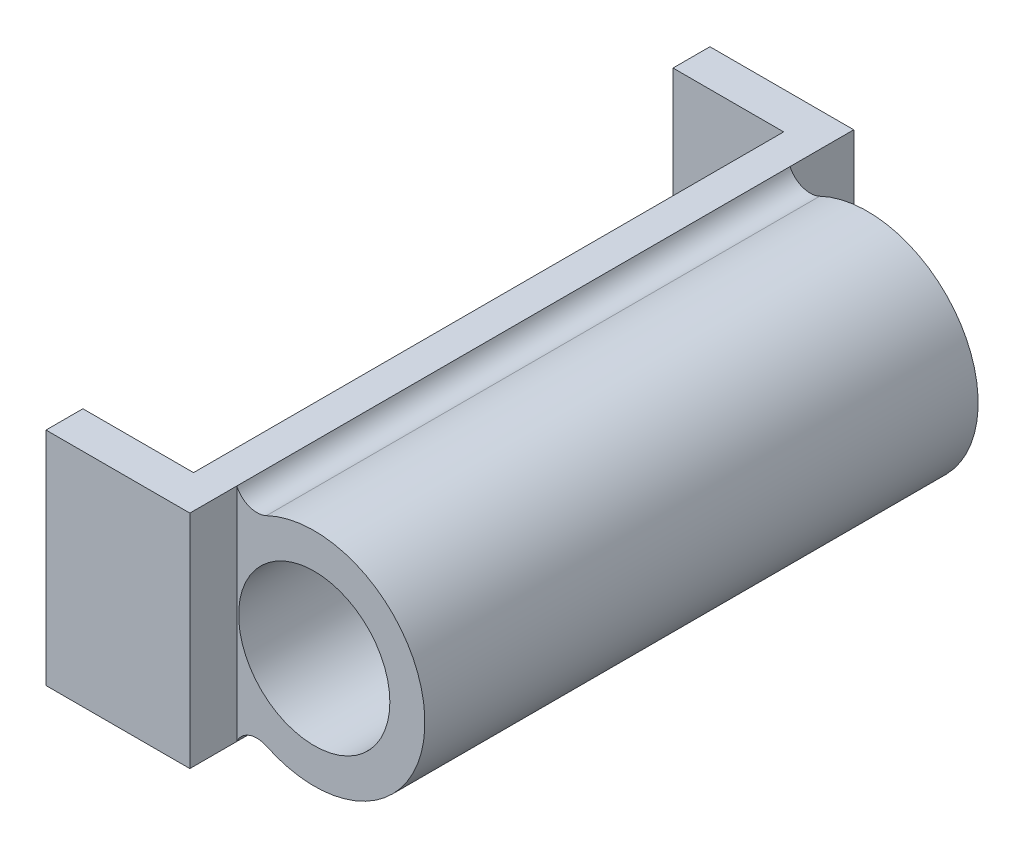
from build123d import *

# Parameters (mm, degrees)
SKETCH_1_W            = 30
SKETCH_1_H            = 30
SKETCH_1_R            = 9.807439468
EXTRUDE_1_DEPTH       = 60
SKETCH_2_W            = 30
SKETCH_2_H            = 30
SKETCH_2_R            = 10.25
EXTRUDE_2_DEPTH       = 50
SKETCH_6_R            = 10.25
CUT_EXTRUDE_1_DEPTH   = 60
SKETCH_7_W            = 30
SKETCH_7_H            = 30
SKETCH_7_R            = 10.25
REVOLVE_1_ANGLE       = 90
FILLET_2_R            = 15
SKETCH_9_W            = 65.452723958
SKETCH_9_H            = 141.93468868
CUT_EXTRUDE_3_DEPTH   = 30
SKETCH_19_W           = 90
SKETCH_19_H           = 60
EXTRUDE_9_DEPTH       = 4.5
SKETCH_20_W           = 5
SKETCH_20_H           = 60
EXTRUDE_10_DEPTH      = 15
EXTRUDE_11_DEPTH      = 25
EXTRUDE_11_DEPTH_BACK = 50
SKETCH_22_R           = 15
SKETCH_22_R_2         = 10.25
SKETCH_26_W           = 90
SKETCH_26_H           = 15
CUT_EXTRUDE_4_DEPTH   = 20
FILLET_4_R            = 3


with BuildPart() as part:
    # 스케치1 → 보스-돌출1 (new body)
    with BuildSketch(Plane.XY):
        Rectangle(SKETCH_1_W, SKETCH_1_H)
        Circle(SKETCH_1_R, mode=Mode.SUBTRACT)
    extrude(amount=EXTRUDE_1_DEPTH)

    # 스케치6 → 컷-돌출1 (cut)
    with BuildSketch(Plane.XY.offset(60)):
        Circle(SKETCH_6_R)
    extrude(amount=-CUT_EXTRUDE_1_DEPTH, mode=Mode.SUBTRACT)



with BuildPart() as body_2:
    # 스케치2 → 보스-돌출2 (new body)
    with BuildSketch(Plane.XZ.offset(15)):
        with Locations((0, 75)):
            Rectangle(SKETCH_2_W, SKETCH_2_H)
        with Locations((0, 75)):
            Circle(SKETCH_2_R, mode=Mode.SUBTRACT)
    extrude(amount=EXTRUDE_2_DEPTH)


with BuildPart() as part_1:
    add(part.part)

    add(body_2.part)  # 회전1 merges body 2
    # 스케치7 → 회전1 (revolve)
    with BuildSketch(Plane(origin=(0, -15, 0), x_dir=(1, 0, 0), z_dir=(0, 1, 0))):
        with Locations((0, -75)):
            Rectangle(SKETCH_7_W, SKETCH_7_H)
        with Locations(Location((0, -75, 0), (0, 0, 270))):
            Circle(SKETCH_7_R, mode=Mode.SUBTRACT)
    revolve(axis=Axis((15, -15, 60), (-1, 0, 0)), revolution_arc=REVOLVE_1_ANGLE)

    # 필렛2
    # the kernel refuses this fillet: 15 mm, written as the material it adds along each edge
    with BuildSketch(Plane(origin=(15, -15, 60), x_dir=(0, 0, -1), z_dir=(-1, 0, 0))) as fillet_2_piece_1:
        with BuildLine():
            CenterArc((FILLET_2_R, FILLET_2_R), FILLET_2_R, 180, 90)
            Line((0, FILLET_2_R), (0, 0))
            Line((0, 0), (FILLET_2_R, 0))
        make_face()
    extrude(amount=30)
    # the kernel refuses this fillet: 15 mm, written as the material it takes off along each edge
    with BuildSketch(Plane(origin=(15, -15, 60), x_dir=(0, 0, 1), z_dir=(0, -1, 0))) as fillet_2_2_piece_1:
        with BuildLine():
            CenterArc((30 - FILLET_2_R, FILLET_2_R), FILLET_2_R, 270, 90)
            Line((30, FILLET_2_R), (30, 0))
            Line((30, 0), (30 - FILLET_2_R, 0))
        make_face()
    revolve(axis=Axis((15, -15, 60), (-1, 0, 0)), revolution_arc=90, mode=Mode.SUBTRACT)
    with BuildSketch(Plane(origin=(-15, -15, 60), x_dir=(0, 0, 1), z_dir=(0, -1, 0))) as fillet_2_2_piece_2:
        with BuildLine():
            CenterArc((30 - FILLET_2_R, -FILLET_2_R), FILLET_2_R, 0, 90)
            Line((30, -FILLET_2_R), (30, 0))
            Line((30, 0), (30 - FILLET_2_R, 0))
        make_face()
    revolve(axis=Axis((-15, -15, 60), (-1, 0, 0)), revolution_arc=90, mode=Mode.SUBTRACT)
    with BuildSketch(Plane(origin=(-15, 15, -37.5), x_dir=(0, -1, 0), z_dir=(0, 0, 1))) as fillet_2_2_piece_3:
        with BuildLine():
            CenterArc((FILLET_2_R, FILLET_2_R), FILLET_2_R, 180, 90)
            Line((0, FILLET_2_R), (0, 0))
            Line((0, 0), (FILLET_2_R, 0))
        make_face()
    extrude(amount=97.5, mode=Mode.SUBTRACT)
    with BuildSketch(Plane(origin=(15, 15, -37.5), x_dir=(0, -1, 0), z_dir=(0, 0, 1))) as fillet_2_2_piece_4:
        with BuildLine():
            CenterArc((FILLET_2_R, -FILLET_2_R), FILLET_2_R, 90, 90)
            Line((0, -FILLET_2_R), (0, 0))
            Line((0, 0), (FILLET_2_R, 0))
        make_face()
    extrude(amount=97.5, mode=Mode.SUBTRACT)
    with BuildSketch(Plane(origin=(-15, -15, 90), x_dir=(0, 0, -1), z_dir=(0, -1, 0))) as fillet_2_2_piece_5:
        with BuildLine():
            CenterArc((FILLET_2_R, FILLET_2_R), FILLET_2_R, 180, 90)
            Line((0, FILLET_2_R), (0, 0))
            Line((0, 0), (FILLET_2_R, 0))
        make_face()
    extrude(amount=87.5, mode=Mode.SUBTRACT)
    with BuildSketch(Plane(origin=(15, -15, 90), x_dir=(0, 0, -1), z_dir=(0, -1, 0))) as fillet_2_2_piece_6:
        with BuildLine():
            CenterArc((FILLET_2_R, -FILLET_2_R), FILLET_2_R, 90, 90)
            Line((0, -FILLET_2_R), (0, 0))
            Line((0, 0), (FILLET_2_R, 0))
        make_face()
    extrude(amount=87.5, mode=Mode.SUBTRACT)
    # the kernel refuses this fillet: 15 mm, written as the material it takes off along each edge
    with BuildSketch(Plane(origin=(-15, -15, 45), x_dir=(1, 0, 0), z_dir=(0, 0, -1)), Plane(origin=(15, -15, -37.5), x_dir=(-1, 0, 0), z_dir=(0, 0, 1))) as fillet_2_3_piece_1:
        with BuildLine():
            CenterArc((FILLET_2_R, -FILLET_2_R), FILLET_2_R, 90, 90)
            Line((0, -FILLET_2_R), (0, 0))
            Line((0, 0), (FILLET_2_R, 0))
        make_face()
    extrude(amount=82.5, mode=Mode.SUBTRACT)
    with BuildSketch(Plane(origin=(15, -30, 60), x_dir=(0, 0, 1), z_dir=(0, -1, 0))) as fillet_2_3_piece_2:
        with BuildLine():
            CenterArc((FILLET_2_R, FILLET_2_R), FILLET_2_R, 180, 90)
            Line((0, FILLET_2_R), (0, 0))
            Line((0, 0), (FILLET_2_R, 0))
        make_face()
    extrude(amount=72.5, mode=Mode.SUBTRACT)
    with BuildSketch(Plane(origin=(-15, -30, 60), x_dir=(0, 0, 1), z_dir=(0, -1, 0))) as fillet_2_3_piece_3:
        with BuildLine():
            CenterArc((FILLET_2_R, -FILLET_2_R), FILLET_2_R, 90, 90)
            Line((0, -FILLET_2_R), (0, 0))
            Line((0, 0), (FILLET_2_R, 0))
        make_face()
    extrude(amount=72.5, mode=Mode.SUBTRACT)
    with BuildSketch(Plane(origin=(-15, -30, 45), x_dir=(0, 1, 0), z_dir=(0, 0, -1))) as fillet_2_3_piece_4:
        with BuildLine():
            CenterArc((15 + FILLET_2_R, FILLET_2_R), FILLET_2_R, 180, 90)
            Line((15, FILLET_2_R), (15, 0))
            Line((15, 0), (15 + FILLET_2_R, 0))
        make_face()
    revolve(axis=Axis((-15, -30, 45), (1, 0, 0)), revolution_arc=90, mode=Mode.SUBTRACT)
    with BuildSketch(Plane(origin=(15, -30, 45), x_dir=(0, 1, 0), z_dir=(0, 0, -1))) as fillet_2_3_piece_5:
        with BuildLine():
            CenterArc((15 + FILLET_2_R, -FILLET_2_R), FILLET_2_R, 90, 90)
            Line((15 + FILLET_2_R, 0), (15, 0))
            Line((15, 0), (15, -FILLET_2_R))
        make_face()
    revolve(axis=Axis((15, -30, 45), (1, 0, 0)), revolution_arc=90, mode=Mode.SUBTRACT)

    # 스케치9 → 컷-돌출3 (cut)
    with BuildSketch(Plane(origin=(15, 0, 0), x_dir=(0, 0, -1), z_dir=(1, 0, 0))):
        with Locations((-60, 0)):
            Rectangle(SKETCH_9_W, SKETCH_9_H)
    extrude(amount=-CUT_EXTRUDE_3_DEPTH, mode=Mode.SUBTRACT)

    # 스케치19 → 보스-돌출9 (add)
    with BuildSketch(Plane(origin=(-15, -15, 60), x_dir=(0, 0, -1), z_dir=(1, 0, 0))):
        with Locations((46.36318099, 15)):
            Rectangle(SKETCH_19_W, SKETCH_19_H)
    extrude(amount=EXTRUDE_9_DEPTH)

    # 스케치20 → 보스-돌출10 (add)
    with BuildSketch(Plane.ZY.offset(15)):
        with Locations((56.13681901, 0)):
            Rectangle(SKETCH_20_W, SKETCH_20_H)
        with Locations((-28.86318099, 0)):
            Rectangle(SKETCH_20_W, SKETCH_20_H)
    extrude(amount=EXTRUDE_10_DEPTH)

    # 스케치22 → 보스-돌출11 (add, two sides: drawn at the far end of the back side and taken through both)
    with BuildSketch(Plane.XY.offset(27.273638021).offset(-EXTRUDE_11_DEPTH_BACK)):
        Circle(SKETCH_22_R)
        Circle(SKETCH_22_R_2, mode=Mode.SUBTRACT)
    extrude(amount=EXTRUDE_11_DEPTH + EXTRUDE_11_DEPTH_BACK)

    # 스케치26 → 컷-돌출4 (cut)
    with BuildSketch(Plane(origin=(-10.5, 0, 0), x_dir=(0, 0, -1), z_dir=(1, 0, 0))):
        with Locations((-13.63681901, -22.5)):
            Rectangle(SKETCH_26_W, SKETCH_26_H)
        with Locations((-13.63681901, 22.5)):
            Rectangle(SKETCH_26_W, SKETCH_26_H)
    extrude(amount=-CUT_EXTRUDE_4_DEPTH, mode=Mode.SUBTRACT)

    # 필렛4
    # the kernel refuses this fillet: 3 mm, written as the material it adds along each edge
    with BuildSketch(Plane(origin=(-10.5, -10.712142643, 27.273638021), x_dir=(0.8191977687507059, -0.573511129511769, 0), z_dir=(0, 0, -1))) as fillet_4_piece_1:
        with BuildLine():
            CenterArc((5.4076958, 2.959446042), FILLET_4_R, 169.374679788, 91.193748437)
            Line((2.459133916, 3.51260318), (2.400162678, 3.523666322))
            ThreePointArc((2.400162678, 3.523666322), (1.180415092, 1.790712258), (-0.049151866, 0.034410668))
            Line((-0.049151866, 0.034410668), (0.009832174, -0.059188921))
            ThreePointArc((0.009832174, -0.059188921), (2.458043545, 0.142769789), (4.906254916, -0.059188921))
            Line((4.906254916, -0.059188921), (4.916087091, 0))
        make_face()
    extrude(amount=27.273638021)
    with BuildSketch(Plane(origin=(-10.5, 10.712142643, 27.273638021), x_dir=(0.8191977687507056, 0.5735111295117695, 0), z_dir=(0, 0, -1))) as fillet_4_piece_2:
        with BuildLine():
            CenterArc((5.4076958, -2.959446042), FILLET_4_R, 99.431571775, 91.193748437)
            Line((2.459133916, -3.51260318), (2.400162678, -3.523666322))
            ThreePointArc((2.400162678, -3.523666322), (1.180415092, -1.790712258), (-0.049151866, -0.034410668))
            Line((-0.049151866, -0.034410668), (0.009832174, 0.059188921))
            ThreePointArc((0.009832174, 0.059188921), (2.458043545, -0.142769789), (4.906254916, 0.059188921))
            Line((4.906254916, 0.059188921), (4.916087091, 0))
        make_face()
    extrude(amount=27.273638021)
    with BuildSketch(Plane(origin=(-10.5, 10.712142643, 52.273638021), x_dir=(0, 1, 0), z_dir=(0, 0, -1))) as fillet_4_piece_3:
        with BuildLine():
            CenterArc((5.525745321, 2.732697091), FILLET_4_R, 154.43613955, 91.193748437)
            Line((2.81943066, 4.027247576), (2.765304367, 4.053138585))
            ThreePointArc((2.765304367, 4.053138585), (1.526672022, 1.931743725), (-0.042848571, 0.042))
            Line((-0.042848571, 0.042), (0, -0.06))
            ThreePointArc((0, -0.06), (2.143928679, -0.06), (4.263099598, -0.054653942))
            Line((4.263099598, -0.054653942), (4.287857357, 0))
        make_face()
    extrude(amount=25)
    with BuildSketch(Plane(origin=(-10.5, 10.712142643, -22.726361979), x_dir=(0, 1, 0), z_dir=(0, 0, 1))) as fillet_4_piece_4:
        with BuildLine():
            CenterArc((5.525745321, -2.732697091), FILLET_4_R, 114.370112013, 91.193748437)
            Line((2.81943066, -4.027247576), (2.765304367, -4.053138585))
            ThreePointArc((2.765304367, -4.053138585), (1.526672022, -1.931743725), (-0.042848571, -0.042))
            Line((-0.042848571, -0.042), (0, 0.06))
            ThreePointArc((0, 0.06), (2.143928679, 0.06), (4.263099598, 0.054653942))
            Line((4.263099598, 0.054653942), (4.287857357, 0))
        make_face()
    extrude(amount=22.726361979)
    with BuildSketch(Plane(origin=(-10.5, -10.712142643, 52.273638021), x_dir=(0.8191977687507062, -0.5735111295117684, 0), z_dir=(0, 0, -1))) as fillet_4_piece_5:
        with BuildLine():
            CenterArc((5.4076958, 2.959446042), FILLET_4_R, 169.374679788, 91.193748437)
            Line((2.459133916, 3.51260318), (2.400162678, 3.523666322))
            ThreePointArc((2.400162678, 3.523666322), (1.180415092, 1.790712258), (-0.049151866, 0.034410668))
            Line((-0.049151866, 0.034410668), (0.009832174, -0.059188921))
            ThreePointArc((0.009832174, -0.059188921), (2.458043545, 0.142769789), (4.906254916, -0.059188921))
            Line((4.906254916, -0.059188921), (4.916087091, 0))
        make_face()
    extrude(amount=25)
    with BuildSketch(Plane(origin=(-10.5, -10.712142643, -22.726361979), x_dir=(0.8191977687507059, -0.5735111295117687, 0), z_dir=(0, 0, 1))) as fillet_4_piece_6:
        with BuildLine():
            CenterArc((5.4076958, -2.959446042), FILLET_4_R, 99.431571775, 91.193748437)
            Line((2.459133916, -3.51260318), (2.400162678, -3.523666322))
            ThreePointArc((2.400162678, -3.523666322), (1.180415092, -1.790712258), (-0.049151866, -0.034410668))
            Line((-0.049151866, -0.034410668), (0.009832174, 0.059188921))
            ThreePointArc((0.009832174, 0.059188921), (2.458043545, -0.142769789), (4.906254916, 0.059188921))
            Line((4.906254916, 0.059188921), (4.916087091, 0))
        make_face()
    extrude(amount=22.726361979)


solid = part_1.part
